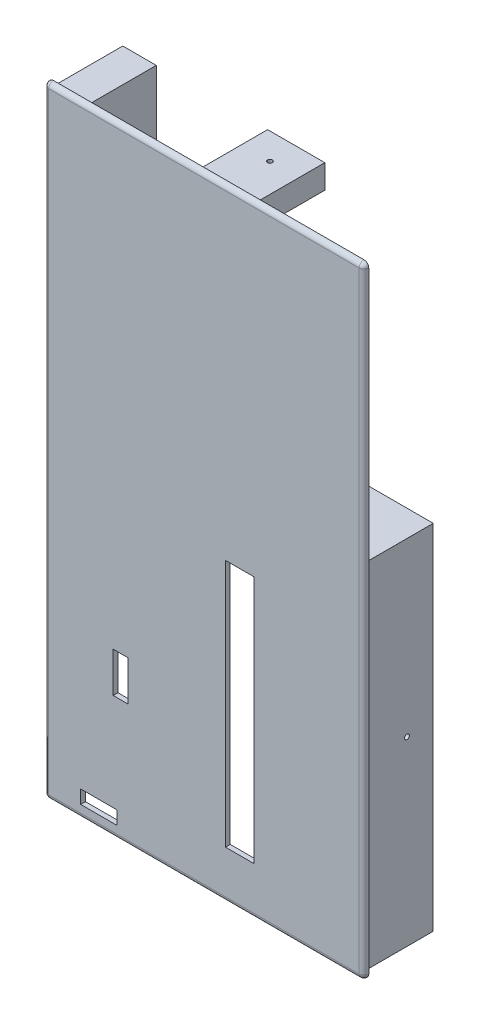
from build123d import *

# Parameters (mm, degrees)
SCHIZZO1_W                   = 67
SCHIZZO1_H                   = 130
ESTRUSIONE_ESTRUSIONE1_DEPTH = 1
RACCORDO1_R                  = 1
RACCORDO2_R                  = 1
TAGLIO_ESTRUSIONE1_REACH     = 75.132
SCHIZZO2_W                   = 6
SCHIZZO2_H                   = 52
SCHIZZO3_W                   = 7.019243903
SCHIZZO3_H                   = 58.993368718
SCHIZZO3_W_2                 = 11.981035511
SCHIZZO3_H_2                 = 5
ESTRUSIONE_ESTRUSIONE2_DEPTH = 14.5
TAGLIO_ESTRUSIONE3_REACH     = 76.75
SCHIZZO8_W                   = 3.086111391
SCHIZZO8_H                   = 8.391810393
TAGLIO_ESTRUSIONE4_REACH     = 76.75
SCHIZZO10_W                  = 7.563253313
SCHIZZO10_H                  = 2.803619763
SCHIZZO11_R                  = 0.5
TAGLIO_ESTRUSIONE5_DEPTH     = 10
SCHIZZO12_R                  = 0.5
TAGLIO_ESTRUSIONE6_DEPTH     = 10
SCHIZZO13_R                  = 0.5
TAGLIO_ESTRUSIONE7_DEPTH     = 10
SCHIZZO14_R                  = 0.5
TAGLIO_ESTRUSIONE8_DEPTH     = 10


# Some blends are built 0.0001 mm under size
with BuildPart() as part:
    # Schizzo1 → Estrusione-Estrusione1 (new body)
    with BuildSketch(Plane.XY):
        Rectangle(SCHIZZO1_W, SCHIZZO1_H)
    extrude(amount=ESTRUSIONE_ESTRUSIONE1_DEPTH)

    # Raccordo1
    raccordo1_edges = [part.edges().sort_by_distance(p)[0] for p in [
        (0, 65, 1),
        (33.5, 0, 1),
        (0, -65, 1),
        (-33.5, 0, 1),
    ]]
    fillet(raccordo1_edges, radius=RACCORDO1_R - 0.0001)  # a hair under: the kernel refuses the full size

    # Raccordo2
    # the kernel refuses this fillet: 1 mm, written as the material it takes off along each edge
    with BuildSketch(Plane(origin=(32.5, -64, 1), x_dir=(0, -1, 0), z_dir=(-1, 0, 0))) as raccordo2_piece_1:
        with BuildLine():
            CenterArc((0.0001, -0.9999), 0.9999, 0, 90)
            Line((1, -0.9999), (1, 0))
            Line((1, 0), (0.0001, 0))
        make_face()
    revolve(axis=Axis((32.5, -64, 1), (0, 0, 1)), revolution_arc=90, mode=Mode.SUBTRACT)
    with BuildSketch(Plane(origin=(-32.5, -64, 1), x_dir=(-1, 0, 0), z_dir=(0, 1, 0))) as raccordo2_piece_2:
        with BuildLine():
            CenterArc((0.0001, -0.9999), 0.9999, 0, 90)
            Line((1, -0.9999), (1, 0))
            Line((1, 0), (0.0001, 0))
        make_face()
    revolve(axis=Axis((-32.5, -64, 1), (0, 0, 1)), revolution_arc=90, mode=Mode.SUBTRACT)
    with BuildSketch(Plane(origin=(32.5, 64, 1), x_dir=(1, 0, 0), z_dir=(0, -1, 0))) as raccordo2_piece_3:
        with BuildLine():
            CenterArc((0.0001, -0.9999), 0.9999, 0, 90)
            Line((1, -0.9999), (1, 0))
            Line((1, 0), (0.0001, 0))
        make_face()
    revolve(axis=Axis((32.5, 64, 1), (0, 0, 1)), revolution_arc=90, mode=Mode.SUBTRACT)
    with BuildSketch(Plane(origin=(-32.5, 64, 1), x_dir=(0, 1, 0), z_dir=(1, 0, 0))) as raccordo2_piece_4:
        with BuildLine():
            CenterArc((0.0001, -0.9999), 0.9999, 0, 90)
            Line((1, -0.9999), (1, 0))
            Line((1, 0), (0.0001, 0))
        make_face()
    revolve(axis=Axis((-32.5, 64, 1), (0, 0, 1)), revolution_arc=90, mode=Mode.SUBTRACT)
    with BuildSketch(Plane(origin=(-33.5, 65, -2.5), x_dir=(1, 0, 0), z_dir=(0, 0, 1)), Plane(origin=(-33.5, -65, -2.5), x_dir=(0, 1, 0), z_dir=(0, 0, 1))) as raccordo2_piece_5:
        with BuildLine():
            CenterArc((RACCORDO2_R, -RACCORDO2_R), RACCORDO2_R, 90, 90)
            Line((0, -RACCORDO2_R), (0, 0))
            Line((0, 0), (RACCORDO2_R, 0))
        make_face()
    extrude(amount=3.5, mode=Mode.SUBTRACT)
    with BuildSketch(Plane(origin=(33.5, 65, -2.5), x_dir=(-1, 0, 0), z_dir=(0, 0, 1)), Plane(origin=(33.5, -65, -2.5), x_dir=(0, 1, 0), z_dir=(0, 0, 1))) as raccordo2_piece_6:
        with BuildLine():
            CenterArc((RACCORDO2_R, RACCORDO2_R), RACCORDO2_R, 180, 90)
            Line((0, RACCORDO2_R), (0, 0))
            Line((0, 0), (RACCORDO2_R, 0))
        make_face()
    extrude(amount=3.5, mode=Mode.SUBTRACT)

    # Schizzo2 → Taglio-Estrusione1 (cut, up to next)
    with BuildSketch(Plane.XY.offset(1), mode=Mode.PRIVATE) as taglio_estrusione1_sk1:
        with Locations((7.5, -29)):
            Rectangle(SCHIZZO2_W, SCHIZZO2_H)
    taglio_estrusione1_tool1 = extrude(taglio_estrusione1_sk1.sketch, amount=-TAGLIO_ESTRUSIONE1_REACH, mode=Mode.PRIVATE) & part.part
    add(taglio_estrusione1_tool1.solids().sort_by_distance((7.5, -29, 1))[0], mode=Mode.SUBTRACT)

    # Schizzo3 → Estrusione-Estrusione2 (add)
    with BuildSketch(Plane(origin=(0, 0, 0), x_dir=(-1, 0, 0), z_dir=(0, 0, -1))):
        Polygon((-32.5, -64), (-10.5, -64), (-10.5, 5.006631282), (-4.308376316, 5.006631282), (-4.308376316, 9.963903227), (-32.5, 9.963903227), (-32.5, 5), align=None)
        with Locations((28.990378048, 34.503315641)):
            Rectangle(SCHIZZO3_W, SCHIZZO3_H)
        with Locations((-3.813832367, 61.5)):
            Rectangle(SCHIZZO3_W_2, SCHIZZO3_H_2)
    extrude(amount=ESTRUSIONE_ESTRUSIONE2_DEPTH)

    # Schizzo8 → Taglio-Estrusione3 (cut, up to next)
    with BuildSketch(Plane.XY.offset(1), mode=Mode.PRIVATE) as taglio_estrusione3_sk1:
        with Locations((-17.456944304, -35.054094803)):
            Rectangle(SCHIZZO8_W, SCHIZZO8_H)
    taglio_estrusione3_tool1 = extrude(taglio_estrusione3_sk1.sketch, amount=-TAGLIO_ESTRUSIONE3_REACH, mode=Mode.PRIVATE) & part.part
    add(taglio_estrusione3_tool1.solids().sort_by_distance((-17.456944, -35.054095, 1))[0], mode=Mode.SUBTRACT)

    # Schizzo10 → Taglio-Estrusione4 (cut, up to next)
    with BuildSketch(Plane.XY.offset(1), mode=Mode.PRIVATE) as taglio_estrusione4_sk1:
        with Locations((-22.018373344, -60.998190119)):
            Rectangle(SCHIZZO10_W, SCHIZZO10_H)
    taglio_estrusione4_tool1 = extrude(taglio_estrusione4_sk1.sketch, amount=-TAGLIO_ESTRUSIONE4_REACH, mode=Mode.PRIVATE) & part.part
    add(taglio_estrusione4_tool1.solids().sort_by_distance((-22.018373, -60.99819, 1))[0], mode=Mode.SUBTRACT)

    # Schizzo11 → Taglio-Estrusione5 (cut)
    with BuildSketch(Plane(origin=(32.5, 0, 0), x_dir=(0, 0, -1), z_dir=(1, 0, 0))):
        with Locations(Location((9, -26, 0), (0, 0, 90))):
            Circle(SCHIZZO11_R)
    extrude(amount=-TAGLIO_ESTRUSIONE5_DEPTH, mode=Mode.SUBTRACT)

    # Schizzo12 → Taglio-Estrusione6 (cut)
    with BuildSketch(Plane(origin=(0, 64, 0), x_dir=(1, 0, 0), z_dir=(0, 1, 0))):
        with Locations(Location((3.813832367, 9, 0), (0, 0, 270))):
            Circle(SCHIZZO12_R)
    extrude(amount=-TAGLIO_ESTRUSIONE6_DEPTH, mode=Mode.SUBTRACT)

    # Schizzo13 → Taglio-Estrusione7 (cut)
    with BuildSketch(Plane.ZY.offset(32.5)):
        with Locations((-9, 36)):
            Circle(SCHIZZO13_R)
    extrude(amount=-TAGLIO_ESTRUSIONE7_DEPTH, mode=Mode.SUBTRACT)

    # Schizzo14 → Taglio-Estrusione8 (cut)
    with BuildSketch(Plane.XZ.offset(64)):
        with Locations(Location((20.5, -9, 0), (0, 0, 270))):
            Circle(SCHIZZO14_R)
    extrude(amount=-TAGLIO_ESTRUSIONE8_DEPTH, mode=Mode.SUBTRACT)


solid = part.part
